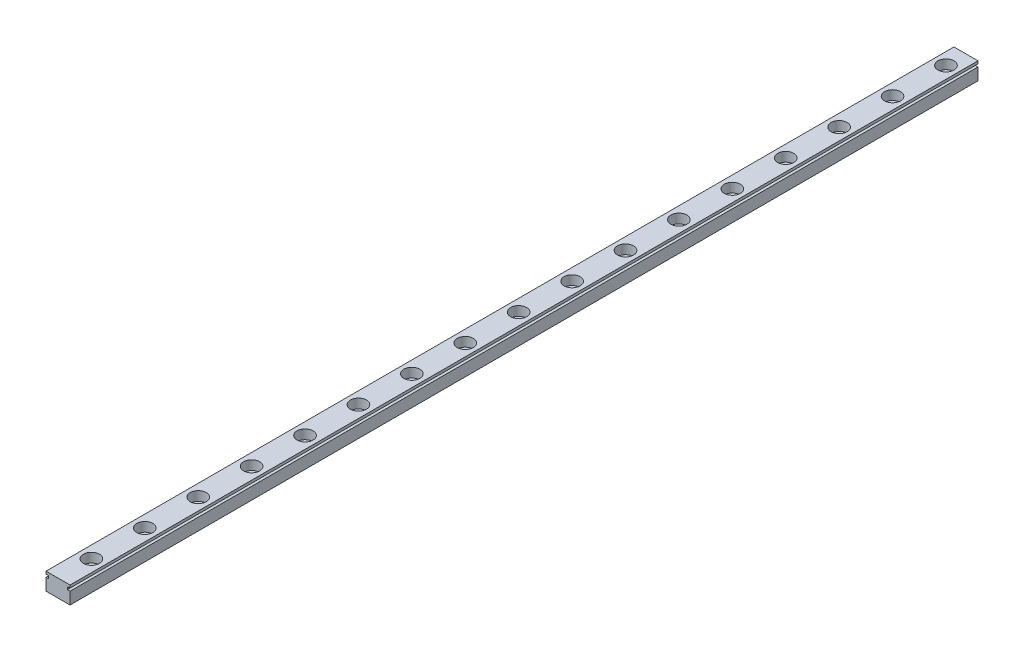
from build123d import *

# Parameters (mm, degrees)
EXTRUDE_1_DEPTH        = 340
PATTERN_LINEAR_1_COUNT = 17
PATTERN_LINEAR_1_PITCH = 20


with BuildPart() as part:
    # 草图1 → 凸台-拉伸1 (new body)
    with BuildSketch(Plane.XY):
        Polygon((-4.5, 0), (4.5, 0), (4.5, 4.5), (3.5, 4.5), (3.5, 5.5), (4.5, 5.5), (4.5, 6.5), (-4.5, 6.5), (-4.5, 5.5), (-3.5, 5.5), (-3.5, 4.5), (-4.5, 4.5), align=None)
    extrude(amount=EXTRUDE_1_DEPTH)

    # 草图2 → 切除-旋转1 (revolve, cut)
    with BuildSketch(Plane(origin=(0, 0, 0), x_dir=(0, 0, -1), z_dir=(1, 0, 0))):
        Polygon((-7.5, 0), (-6, 0), (-6, 3), (-4.5, 3), (-4.5, 6.5), (-7.5, 6.5), align=None)
    cut_revolve_1 = revolve(axis=Axis((0, 7.615907336, 7.5), (0, -1, 0)), mode=Mode.SUBTRACT)

    # 阵列(线性)1: 切除-旋转1 ×17
    with Locations(*[(0, 0, i * PATTERN_LINEAR_1_PITCH) for i in range(1, PATTERN_LINEAR_1_COUNT)]):
        add(cut_revolve_1, mode=Mode.SUBTRACT)


solid = part.part
